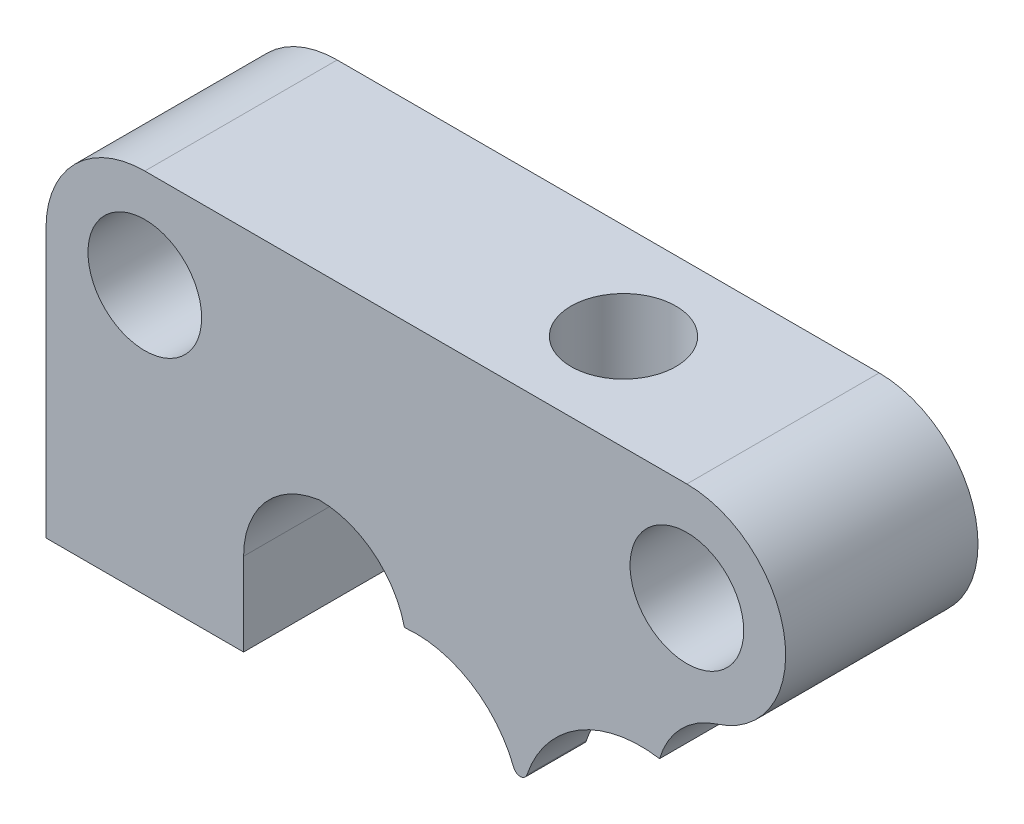
from build123d import *

# Parameters (mm, degrees)
BOSS_EXTRUDE1_DEPTH      = 5.5
BOSS_EXTRUDE1_DEPTH_BACK = 5.5
SKETCH1_R                = 1.6
SKETCH4_R                = 3
CUT_EXTRUDE2_DEPTH       = 5
BOSS_EXTRUDE2_DEPTH      = 11
FILLET1_R                = 0.4
SKETCH7_R                = 0.95
CUT_EXTRUDE3_DEPTH       = 30.124654232
CUT_EXTRUDE5_DEPTH       = 10
CUT_EXTRUDE5_DEPTH_BACK  = 30.124654236
CUT_EXTRUDE5_START       = -18.97961
SKETCH8_R                = 2.1
FILLET2_R                = 5
SKETCH9_R                = 3.25
CUT_EXTRUDE6_DEPTH       = 8
BOSS_EXTRUDE3_START      = -11
SKETCH10_W               = 5.65
SKETCH10_H               = 9.7
BOSS_EXTRUDE3_DEPTH      = 11
SKETCH11_R               = 3.7
CUT_EXTRUDE7_DEPTH       = 3
FILLET3_R                = 5


with BuildPart() as part:
    # Sketch1 → Boss-Extrude1 (new, two sides: drawn at the far end of the back side and taken through both)
    with BuildSketch(Plane.XY.offset(-BOSS_EXTRUDE1_DEPTH_BACK)):
        with BuildLine():
            Line((-15.5, 5.65), (15.5, 5.65))
            ThreePointArc((15.5, 5.65), (21.15, 0), (15.5, -5.65))
            Line((15.5, -5.65), (-15.5, -5.65))
            ThreePointArc((-15.5, -5.65), (-21.15, 0), (-15.5, 5.65))
        make_face()
        with Locations((-15.5, 0)):
            Circle(SKETCH1_R, mode=Mode.SUBTRACT)
        with Locations(Location((15.5, 0, 0), (0, 0, 180))):
            Circle(SKETCH1_R, mode=Mode.SUBTRACT)
    extrude(amount=BOSS_EXTRUDE1_DEPTH + BOSS_EXTRUDE1_DEPTH_BACK)

    # Sketch4 → Cut-Extrude2 (cut)
    with BuildSketch(Plane(origin=(0, 5.65, 0), x_dir=(1, 0, 0), z_dir=(0, 1, 0))):
        with Locations(Location((6.375, 0, 0), (0, 0, 180))):
            Circle(SKETCH4_R)
    extrude(amount=-CUT_EXTRUDE2_DEPTH, mode=Mode.SUBTRACT)

    # Sketch6 → Boss-Extrude2 (add)
    with BuildSketch(Plane.XY.offset(5.5)):
        with BuildLine():
            Line((-0.65013639, -9.535327111), (-0.65013639, -5.65))
            Line((-0.65013639, -5.65), (13.939015195, -5.65))
            Line((13.939015195, -5.65), (13.939015195, -8.737119999))
            ThreePointArc((13.939015195, -8.737119999), (8.407998992, -10.285488801), (6, -15.5))
            ThreePointArc((6, -15.5), (4.006194058, -11.03341191), (-0.65013639, -9.535327111))
        make_face()
    extrude(amount=-BOSS_EXTRUDE2_DEPTH)

    # Fillet1
    fillet1_edges = [part.edges().sort_by_distance(p)[0] for p in [
        (6, -15.5, 0),
    ]]
    fillet(fillet1_edges, radius=FILLET1_R)

    # Sketch7 → Cut-Extrude3 (cut, through all)
    with BuildSketch(Plane(origin=(0, 5.65, 0), x_dir=(1, 0, 0), z_dir=(0, 1, 0))):
        with Locations(Location((6.375, 0, 0), (0, 0, 180))):
            Circle(SKETCH7_R)
    extrude(amount=-CUT_EXTRUDE3_DEPTH, mode=Mode.SUBTRACT)

    # Sketch8 → Cut-Extrude5 (cut, two sides: drawn at the far end of the back side and taken through both)
    with BuildSketch(Plane(origin=(0, 5.65, 0), x_dir=(1, 0, 0), z_dir=(0, 1, 0)).offset(CUT_EXTRUDE5_START - CUT_EXTRUDE5_DEPTH_BACK)):
        with Locations(Location((6.375, 0, 0), (0, 0, 180))):
            Circle(SKETCH8_R)
    extrude(amount=CUT_EXTRUDE5_DEPTH + CUT_EXTRUDE5_DEPTH_BACK, mode=Mode.SUBTRACT)

    # Fillet2
    # the kernel refuses this fillet: 5 mm, written as the material it adds along each edge
    with BuildSketch(Plane(origin=(13.939015195, -5.65, 5.5), x_dir=(0, -1, 0), z_dir=(0, 0, -1))) as fillet2_piece_1:
        with BuildLine():
            CenterArc((4.496369398, -4.797292583), FILLET2_R, 106.370642389, 55.938643206)
            Line((-0.26718431, -3.27789926), (-0.743539681, -3.125959928))
            ThreePointArc((-0.743539681, -3.125959928), (-0.5, -1.560984805), (-0.5, 0))
            Line((-0.5, 0), (0, 0.5))
            ThreePointArc((0, 0.5), (1.54356, 0.5), (2.946195059, 0.479729258))
            Line((2.946195059, 0.479729258), (3.087119999, 0))
        make_face()
    extrude(amount=11)
    with BuildSketch(Plane(origin=(-0.65013639, -5.65, 5.5), x_dir=(0, -1, 0), z_dir=(0, 0, -1))) as fillet2_piece_2:
        with BuildLine():
            CenterArc((5, 4.874167042), FILLET2_R, 180, 77.118546425)
            Line((0, 4.874167042), (-0.1, 4.874167042))
            Line((-0.1, 4.874167042), (-0.1, 0))
            Line((-0.1, 0), (0, -0.1))
            ThreePointArc((0, -0.1), (1.942663555, -0.1), (3.863033653, -0.097483341))
            Line((3.863033653, -0.097483341), (3.885327111, 0))
        make_face()
    extrude(amount=11)

    # Sketch9 → Cut-Extrude6 (cut)
    with BuildSketch(Plane.XY.offset(5.5)):
        with Locations((-15.5, 0)):
            Circle(SKETCH9_R)
        with Locations((15.5, 0)):
            Circle(SKETCH9_R)
    extrude(amount=-CUT_EXTRUDE6_DEPTH, mode=Mode.SUBTRACT)

    # Sketch10 → Boss-Extrude3 (add)
    with BuildSketch(Plane.XY.offset(5.5).offset(BOSS_EXTRUDE3_START)):
        with Locations((-12.675, -10.5)):
            Rectangle(SKETCH10_W, SKETCH10_H)
        with BuildLine():
            Line((-15.5, -15.35), (-15.5, -5.65))
            ThreePointArc((-15.5, -5.65), (-19.495153314, -3.995153314), (-21.15, 0))
            Line((-21.15, 0), (-21.15, -15.35))
            Line((-21.15, -15.35), (-15.5, -15.35))
        make_face()
    extrude(amount=BOSS_EXTRUDE3_DEPTH)

    # Sketch11 → Cut-Extrude7 (cut)
    with BuildSketch(Plane.XZ.offset(15.35)):
        with Locations(Location((-15.5, 0, 0), (0, 0, 270))):
            Circle(SKETCH11_R)
    extrude(amount=-CUT_EXTRUDE7_DEPTH, mode=Mode.SUBTRACT)

    # Fillet3
    # the kernel refuses this fillet: 5 mm, written as the material it adds along each edge
    with BuildSketch(Plane(origin=(-9.85, -5.65, -5.5), x_dir=(1, 0, 0), z_dir=(0, 0, 1))) as fillet3_piece_1:
        with BuildLine():
            CenterArc((5, -4.954322848), FILLET3_R, 97.75056413, 82.24943587)
            Line((0, -4.954322848), (-0.1, -4.954322848))
            Line((-0.1, -4.954322848), (-0.1, 0))
            Line((-0.1, 0), (0, 0.1))
            ThreePointArc((0, 0.1), (2.162848284, 0.1), (4.3122105, 0.099086457))
            Line((4.3122105, 0.099086457), (4.325696569, 0))
        make_face()
    extrude(amount=11)


solid = part.part
